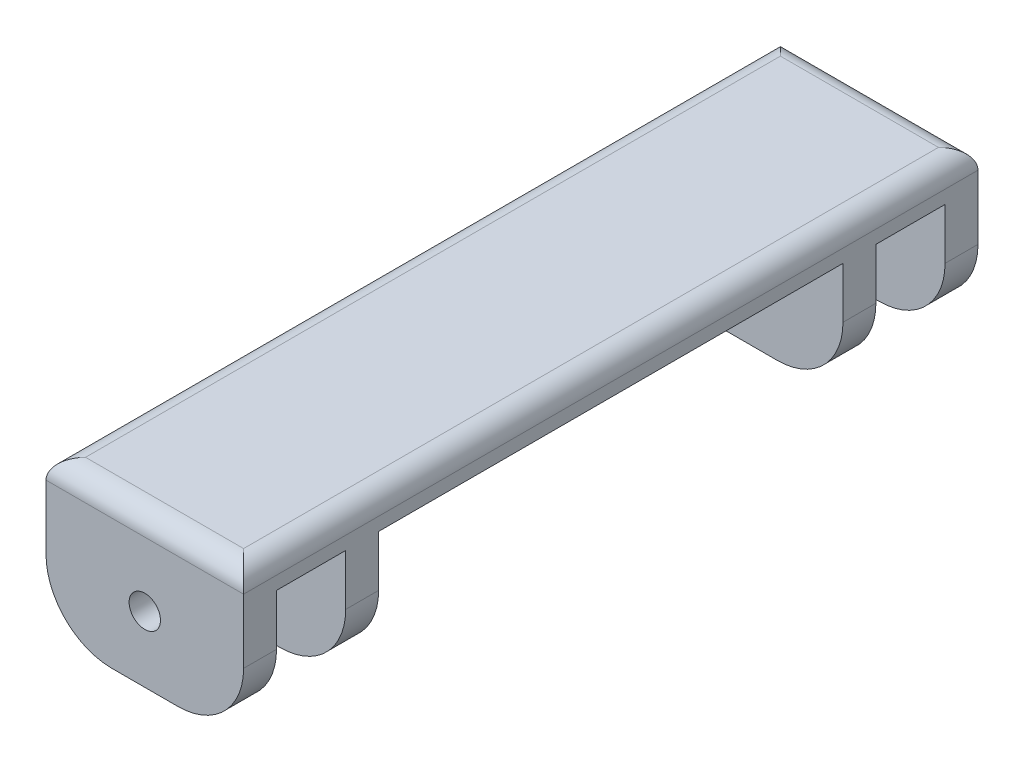
from build123d import *

# Parameters (mm, degrees)
ESQUISSE1_W                             = 30
ESQUISSE1_H                             = 5
BOSS_EXTRU_1_DEPTH                      = 111.5
ESQUISSE2_W                             = 30
ESQUISSE2_H                             = 5
BOSS_EXTRU_2_DEPTH                      = 17.75
PER_AGE_POUR_CROUS_AUTO_BLOQUANTS_300_D = 4.7625
CONG_1_R                                = 10
CONG_2_R                                = 3


with BuildPart() as part:
    # Esquisse1 → Boss.-Extru.1 (new body)
    with BuildSketch(Plane.XY):
        with Locations((15, 2.5)):
            Rectangle(ESQUISSE1_W, ESQUISSE1_H)
    extrude(amount=BOSS_EXTRU_1_DEPTH)

    # Esquisse2 → Boss.-Extru.2 (add)
    with BuildSketch(Plane.XZ):
        with Locations((15, 2.5)):
            Rectangle(ESQUISSE2_W, ESQUISSE2_H)
        with Locations((15, 18)):
            Rectangle(ESQUISSE2_W, ESQUISSE2_H)
        with Locations((15, 109)):
            Rectangle(ESQUISSE2_W, ESQUISSE2_H)
        with Locations((15, 93.5)):
            Rectangle(ESQUISSE2_W, ESQUISSE2_H)
    extrude(amount=BOSS_EXTRU_2_DEPTH)

    # Perçage pour écrous auto-bloquants 300® #6 (SP)1 (through all)
    with Locations(Plane.XY.offset(111.5)):
        with Locations((15, -7.75)):
            Hole(PER_AGE_POUR_CROUS_AUTO_BLOQUANTS_300_D / 2)

    # Congé1
    cong_1_edges = [part.edges().sort_by_distance(p)[0] for p in [
        (0, -17.75, 2.5),
        (30, -17.75, 2.5),
        (30, -17.75, 93.5),
        (30, -17.75, 109),
        (0, -17.75, 93.5),
        (0, -17.75, 109),
        (0, -17.75, 18),
        (30, -17.75, 18),
    ]]
    fillet(cong_1_edges, radius=CONG_1_R)

    # Congé2
    cong_2_edges = [part.edges().sort_by_distance(p)[0] for p in [
        (30, 5, 55.75),
        (15, 5, 111.5),
        (0, 5, 55.75),
        (15, 5, 0),
    ]]
    fillet(cong_2_edges, radius=CONG_2_R)


solid = part.part
